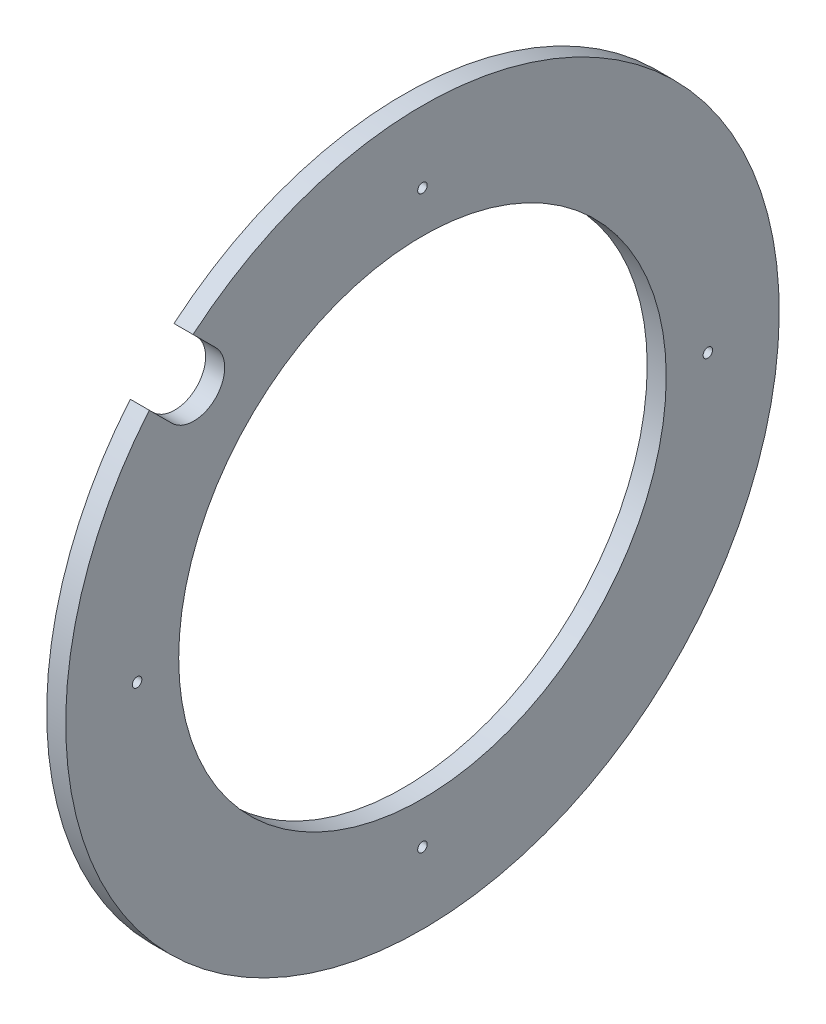
from build123d import *

# Parameters (mm, degrees)
ESQUISSE1_R        = 75
ESQUISSE1_R_2      = 51.25
BOSS_EXTRU_1_DEPTH = 4
SKETCH1_R          = 1
AIR_VENTS_DEPTH    = 107.141415103
CUT_EXTRUDE1_DEPTH = 10


with BuildPart() as part:
    # Esquisse1 → Boss.-Extru.1 (new body)
    with BuildSketch(Plane(origin=(0, 0, 0), x_dir=(0, 0, -1), z_dir=(1, 0, 0))):
        Circle(ESQUISSE1_R)
        Circle(ESQUISSE1_R_2, mode=Mode.SUBTRACT)
    extrude(amount=BOSS_EXTRU_1_DEPTH)

    # Sketch1 → air vents (cut, through all)
    with BuildSketch(Plane(origin=(4, 0, 0), x_dir=(0, 0, -1), z_dir=(1, 0, 0))):
        with Locations((0, 60)):
            Circle(SKETCH1_R)
        with Locations((60, 0)):
            Circle(SKETCH1_R)
        with Locations((0, -60)):
            Circle(SKETCH1_R)
        with Locations((-60, 0)):
            Circle(SKETCH1_R)
    extrude(amount=-AIR_VENTS_DEPTH, mode=Mode.SUBTRACT)

    # Sketch2 → Cut-Extrude1 (cut)
    with BuildSketch(Plane(origin=(4, 0, 0), x_dir=(0, 0, -1), z_dir=(1, 0, 0))):
        with BuildLine():
            Line((-43.487067043, 52.679455198), (-81.600352415, 90.79274057))
            Line((-81.600352415, 90.79274057), (-92.273966974, 83.081578819))
            Line((-92.273966974, 83.081578819), (-52.679455198, 43.487067043))
            ThreePointArc((-52.679455198, 43.487067043), (-43.487067043, 43.487067043), (-43.487067043, 52.679455198))
        make_face()
    extrude(amount=-CUT_EXTRUDE1_DEPTH, mode=Mode.SUBTRACT)


solid = part.part
